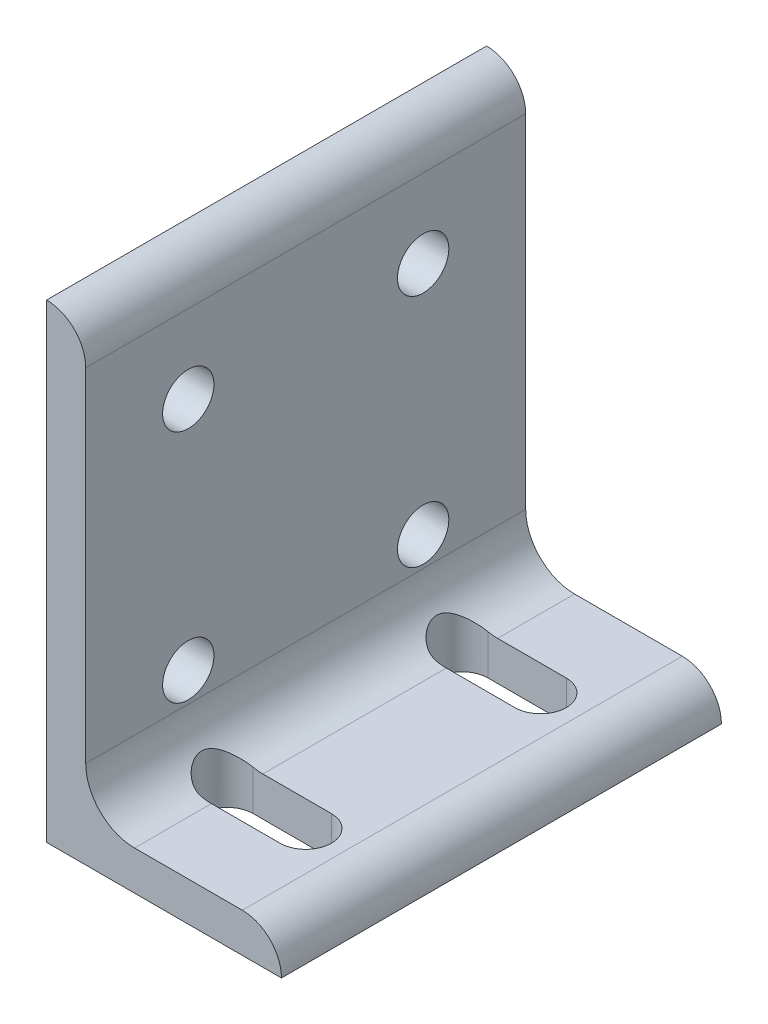
from build123d import *

# Parameters (mm, degrees)
BOSS_EXTRUDE1_DEPTH = 35.687
FILLET1_R           = 6.35
CUT_EXTRUDE1_REACH  = 94.367
SKETCH4_R           = 4.1656
CUT_EXTRUDE2_DEPTH  = 93.366725481


with BuildPart() as part:
    # Sketch2 → Boss-Extrude1 (new, symmetric)
    with BuildSketch(Plane.XY):
        with BuildLine():
            Line((0, 0), (0, 76.2))
            Line((0, 76.2), (6.35, 76.2))
            Line((6.35, 76.2), (6.35, 14.2748))
            ThreePointArc((6.35, 14.2748), (8.67112018, 8.67112018), (14.2748, 6.35))
            Line((14.2748, 6.35), (38.1, 6.35))
            Line((38.1, 6.35), (38.1, 0))
            Line((38.1, 0), (0, 0))
        make_face()
    extrude(amount=BOSS_EXTRUDE1_DEPTH, both=True)

    # Fillet1
    fillet1_edges = [part.edges().sort_by_distance(p)[0] for p in [
        (38.1, 6.35, 0),
        (6.35, 76.2, 0),
    ]]
    fillet(fillet1_edges, radius=FILLET1_R - 0.0001)  # a hair under: the kernel refuses the full size

    # Sketch3 → Cut-Extrude1 (cut, up to next)
    with BuildSketch(Plane.XZ, mode=Mode.PRIVATE) as cut_extrude1_sk1:
        with BuildLine():
            Line((25.4, 14.8844), (12.7, 14.8844))
            ThreePointArc((12.7, 14.8844), (8.5344, 19.05), (12.7, 23.2156))
            Line((12.7, 23.2156), (25.4, 23.2156))
            ThreePointArc((25.4, 23.2156), (29.5656, 19.05), (25.4, 14.8844))
        make_face()
    cut_extrude1_tool1 = extrude(cut_extrude1_sk1.sketch, amount=-CUT_EXTRUDE1_REACH, mode=Mode.PRIVATE) & part.part
    # Sketch3 → Cut-Extrude1 (cut, up to next)
    with BuildSketch(Plane.XZ, mode=Mode.PRIVATE) as cut_extrude1_sk2:
        with BuildLine():
            Line((25.4, -23.2156), (12.7, -23.2156))
            ThreePointArc((12.7, -23.2156), (8.5344, -19.05), (12.7, -14.8844))
            Line((12.7, -14.8844), (25.4, -14.8844))
            ThreePointArc((25.4, -14.8844), (29.5656, -19.05), (25.4, -23.2156))
        make_face()
    cut_extrude1_tool2 = extrude(cut_extrude1_sk2.sketch, amount=-CUT_EXTRUDE1_REACH, mode=Mode.PRIVATE) & part.part
    add(cut_extrude1_tool1.solids().sort_by_distance((19.05, 0, 19.05))[0], mode=Mode.SUBTRACT)
    add(cut_extrude1_tool2.solids().sort_by_distance((19.05, 0, -19.05))[0], mode=Mode.SUBTRACT)

    # Sketch4 → Cut-Extrude2 (cut, through all)
    with BuildSketch(Plane.ZY):
        with Locations(Location((19.05, 57.15, 0), (0, 0, 270))):
            Circle(SKETCH4_R)
        with Locations(Location((-19.05, 19.05, 0), (0, 0, 270))):
            Circle(SKETCH4_R)
        with Locations(Location((-19.05, 57.15, 0), (0, 0, 270))):
            Circle(SKETCH4_R)
        with Locations(Location((19.05, 19.05, 0), (0, 0, 270))):
            Circle(SKETCH4_R)
    extrude(amount=-CUT_EXTRUDE2_DEPTH, mode=Mode.SUBTRACT)


solid = part.part
